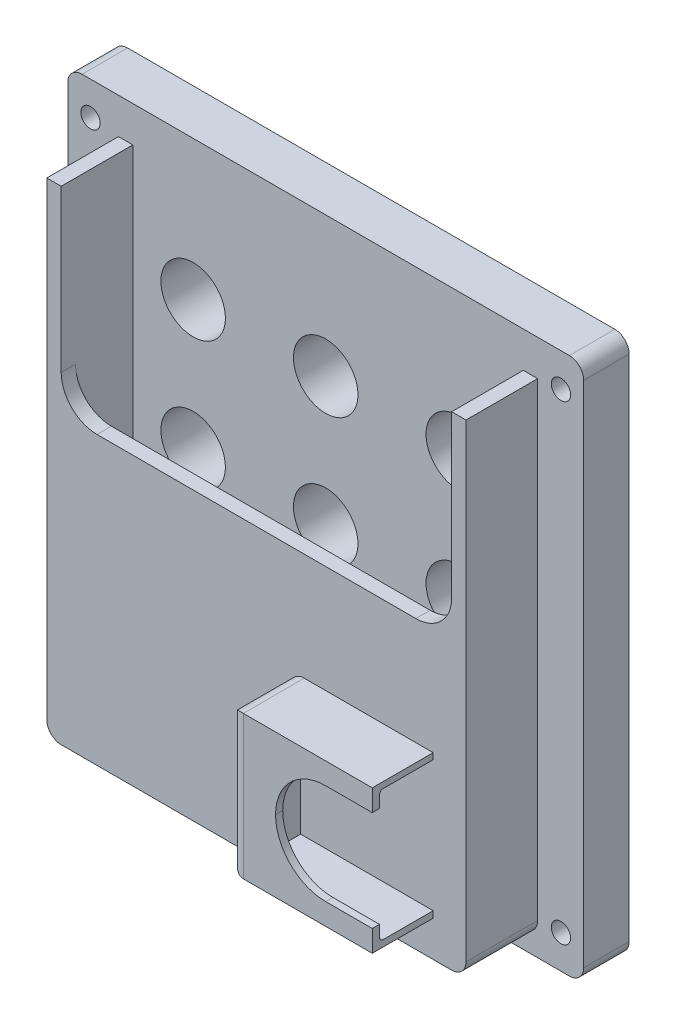
from build123d import *

# Parameters (mm, degrees)
SKETCH1_W           = 72
SKETCH1_H           = 75
SKETCH1_R           = 1.35
BOSS_EXTRUDE1_DEPTH = 6.35
BOSS_EXTRUDE2_DEPTH = 10
SKETCH3_W           = 58.5
SKETCH3_H           = 40
BOSS_EXTRUDE3_DEPTH = 2
FILLET1_R           = 5
SKETCH4_W           = 20
SKETCH4_H           = 20
BOSS_EXTRUDE4_DEPTH = 8.5
SKETCH5_W           = 7.5
SKETCH5_H           = 18.25
CUT_EXTRUDE1_DEPTH  = 18.5
FILLET2_R           = 0.5
FILLET3_R           = 2
FILLET4_R           = 2
CUT_EXTRUDE2_REACH  = 59.617
SKETCH6_W           = 13.5
SKETCH6_H           = 14
FILLET5_R           = 7
CUT_EXTRUDE3_REACH  = 59.617
SKETCH7_R           = 4.5


with BuildPart() as part:
    # Sketch1 → Boss-Extrude1 (new body)
    with BuildSketch(Plane.XY):
        Rectangle(SKETCH1_W, SKETCH1_H)
        with Locations((-32.83, 32.83)):
            Circle(SKETCH1_R, mode=Mode.SUBTRACT)
        with Locations((-32.83, -32.83)):
            Circle(SKETCH1_R, mode=Mode.SUBTRACT)
        with Locations((32.83, 32.83)):
            Circle(SKETCH1_R, mode=Mode.SUBTRACT)
        with Locations((32.83, -32.83)):
            Circle(SKETCH1_R, mode=Mode.SUBTRACT)
    extrude(amount=BOSS_EXTRUDE1_DEPTH)

    # Sketch2 → Boss-Extrude2 (add)
    with BuildSketch(Plane.XY.offset(6.35)):
        Polygon((-26.92, 32.5), (-28.92, 32.5), (-28.92, -35), (29.58, -35), (29.58, 32.5), (27.58, 32.5), (27.58, -32.5), (-26.92, -32.5), align=None)
    extrude(amount=BOSS_EXTRUDE2_DEPTH)

    # Sketch3 → Boss-Extrude3 (add)
    with BuildSketch(Plane.XY.offset(16.35)):
        with Locations((0.33, -15)):
            Rectangle(SKETCH3_W, SKETCH3_H)
    extrude(amount=-BOSS_EXTRUDE3_DEPTH)

    # Fillet1
    fillet1_edges = [part.edges().sort_by_distance(p)[0] for p in [
        (-26.92, 5, 15.35),
        (27.58, 5, 15.35),
    ]]
    fillet(fillet1_edges, radius=FILLET1_R)

    # Sketch4 → Boss-Extrude4 (add)
    with BuildSketch(Plane.XY.offset(16.35)):
        with Locations((15, -20)):
            Rectangle(SKETCH4_W, SKETCH4_H)
    extrude(amount=BOSS_EXTRUDE4_DEPTH)

    # Sketch5 → Cut-Extrude1 (cut)
    with BuildSketch(Plane(origin=(25, 0, 0), x_dir=(0, 0, -1), z_dir=(1, 0, 0))):
        with Locations((-20.1, -19.975)):
            Rectangle(SKETCH5_W, SKETCH5_H)
    extrude(amount=-CUT_EXTRUDE1_DEPTH, mode=Mode.SUBTRACT)

    # Fillet2
    fillet2_edges = [part.edges().sort_by_distance(p)[0] for p in [
        (15.75, -29.1, 23.85),
        (15.75, -10.85, 23.85),
    ]]
    fillet(fillet2_edges, radius=FILLET2_R)

    # Fillet3
    fillet3_edges = [part.edges().sort_by_distance(p)[0] for p in [
        (-28.92, -35, 11.35),
        (29.58, -35, 11.35),
        (36, -37.5, 3.175),
        (-36, -37.5, 3.175),
        (-36, 37.5, 3.175),
        (36, 37.5, 3.175),
    ]]
    fillet(fillet3_edges, radius=FILLET3_R)

    # Fillet4
    fillet4_edges = [part.edges().sort_by_distance(p)[0] for p in [
        (5, -10, 20.6),
        (5, -30, 20.6),
        (5, -20, 24.85),
    ]]
    fillet(fillet4_edges, radius=FILLET4_R)

    # Sketch6 → Cut-Extrude2 (cut, up to next)
    with BuildSketch(Plane.XY.offset(24.85), mode=Mode.PRIVATE) as cut_extrude2_sk1:
        with Locations((18.25, -20)):
            Rectangle(SKETCH6_W, SKETCH6_H)
    cut_extrude2_tool1 = extrude(cut_extrude2_sk1.sketch, amount=-CUT_EXTRUDE2_REACH, mode=Mode.PRIVATE) & part.part
    add(cut_extrude2_tool1.solids().sort_by_distance((18.25, -20, 24.85))[0], mode=Mode.SUBTRACT)

    # Fillet5
    fillet5_edges = [part.edges().sort_by_distance(p)[0] for p in [
        (11.5, -27, 24.35),
        (11.5, -13, 24.35),
    ]]
    fillet(fillet5_edges, radius=FILLET5_R - 0.0001)  # a hair under: the kernel refuses the full size

    # Sketch7 → Cut-Extrude3 (cut, up to next)
    with BuildSketch(Plane(origin=(0, 0, 0), x_dir=(-1, 0, 0), z_dir=(0, 0, -1)), mode=Mode.PRIVATE) as cut_extrude3_sk1:
        with Locations((-18.5, 18)):
            Circle(SKETCH7_R)
    cut_extrude3_tool1 = extrude(cut_extrude3_sk1.sketch, amount=-CUT_EXTRUDE3_REACH, mode=Mode.PRIVATE) & part.part
    # Sketch7 → Cut-Extrude3 (cut, up to next)
    with BuildSketch(Plane(origin=(0, 0, 0), x_dir=(-1, 0, 0), z_dir=(0, 0, -1)), mode=Mode.PRIVATE) as cut_extrude3_sk2:
        with Locations((0, 18)):
            Circle(SKETCH7_R)
    cut_extrude3_tool2 = extrude(cut_extrude3_sk2.sketch, amount=-CUT_EXTRUDE3_REACH, mode=Mode.PRIVATE) & part.part
    # Sketch7 → Cut-Extrude3 (cut, up to next)
    with BuildSketch(Plane(origin=(0, 0, 0), x_dir=(-1, 0, 0), z_dir=(0, 0, -1)), mode=Mode.PRIVATE) as cut_extrude3_sk3:
        with Locations((18.5, 18)):
            Circle(SKETCH7_R)
    cut_extrude3_tool3 = extrude(cut_extrude3_sk3.sketch, amount=-CUT_EXTRUDE3_REACH, mode=Mode.PRIVATE) & part.part
    # Sketch7 → Cut-Extrude3 (cut, up to next)
    with BuildSketch(Plane(origin=(0, 0, 0), x_dir=(-1, 0, 0), z_dir=(0, 0, -1)), mode=Mode.PRIVATE) as cut_extrude3_sk4:
        with Locations((-18.5, 0)):
            Circle(SKETCH7_R)
    cut_extrude3_tool4 = extrude(cut_extrude3_sk4.sketch, amount=-CUT_EXTRUDE3_REACH, mode=Mode.PRIVATE) & part.part
    # Sketch7 → Cut-Extrude3 (cut, up to next)
    with BuildSketch(Plane(origin=(0, 0, 0), x_dir=(-1, 0, 0), z_dir=(0, 0, -1)), mode=Mode.PRIVATE) as cut_extrude3_sk5:
        Circle(SKETCH7_R)
    cut_extrude3_tool5 = extrude(cut_extrude3_sk5.sketch, amount=-CUT_EXTRUDE3_REACH, mode=Mode.PRIVATE) & part.part
    # Sketch7 → Cut-Extrude3 (cut, up to next)
    with BuildSketch(Plane(origin=(0, 0, 0), x_dir=(-1, 0, 0), z_dir=(0, 0, -1)), mode=Mode.PRIVATE) as cut_extrude3_sk6:
        with Locations((18.5, 0)):
            Circle(SKETCH7_R)
    cut_extrude3_tool6 = extrude(cut_extrude3_sk6.sketch, amount=-CUT_EXTRUDE3_REACH, mode=Mode.PRIVATE) & part.part
    # Sketch7 → Cut-Extrude3 (cut, up to next)
    with BuildSketch(Plane(origin=(0, 0, 0), x_dir=(-1, 0, 0), z_dir=(0, 0, -1)), mode=Mode.PRIVATE) as cut_extrude3_sk7:
        with Locations((0, -18)):
            Circle(SKETCH7_R)
    cut_extrude3_tool7 = extrude(cut_extrude3_sk7.sketch, amount=-CUT_EXTRUDE3_REACH, mode=Mode.PRIVATE) & part.part
    # Sketch7 → Cut-Extrude3 (cut, up to next)
    with BuildSketch(Plane(origin=(0, 0, 0), x_dir=(-1, 0, 0), z_dir=(0, 0, -1)), mode=Mode.PRIVATE) as cut_extrude3_sk8:
        with Locations((18.5, -18)):
            Circle(SKETCH7_R)
    cut_extrude3_tool8 = extrude(cut_extrude3_sk8.sketch, amount=-CUT_EXTRUDE3_REACH, mode=Mode.PRIVATE) & part.part
    # Sketch7 → Cut-Extrude3 (cut, up to next)
    with BuildSketch(Plane(origin=(0, 0, 0), x_dir=(-1, 0, 0), z_dir=(0, 0, -1)), mode=Mode.PRIVATE) as cut_extrude3_sk9:
        with Locations((-18.5, -18)):
            Circle(SKETCH7_R)
    cut_extrude3_tool9 = extrude(cut_extrude3_sk9.sketch, amount=-CUT_EXTRUDE3_REACH, mode=Mode.PRIVATE) & part.part
    add(cut_extrude3_tool1.solids().sort_by_distance((18.5, 18, 0))[0], mode=Mode.SUBTRACT)
    add(cut_extrude3_tool2.solids().sort_by_distance((0, 18, 0))[0], mode=Mode.SUBTRACT)
    add(cut_extrude3_tool3.solids().sort_by_distance((-18.5, 18, 0))[0], mode=Mode.SUBTRACT)
    add(cut_extrude3_tool4.solids().sort_by_distance((18.5, 0, 0))[0], mode=Mode.SUBTRACT)
    add(cut_extrude3_tool5.solids().sort_by_distance((0, 0, 0))[0], mode=Mode.SUBTRACT)
    add(cut_extrude3_tool6.solids().sort_by_distance((-18.5, 0, 0))[0], mode=Mode.SUBTRACT)
    add(cut_extrude3_tool7.solids().sort_by_distance((0, -18, 0))[0], mode=Mode.SUBTRACT)
    add(cut_extrude3_tool8.solids().sort_by_distance((-18.5, -18, 0))[0], mode=Mode.SUBTRACT)
    add(cut_extrude3_tool9.solids().sort_by_distance((18.5, -18, 0))[0], mode=Mode.SUBTRACT)


solid = part.part
